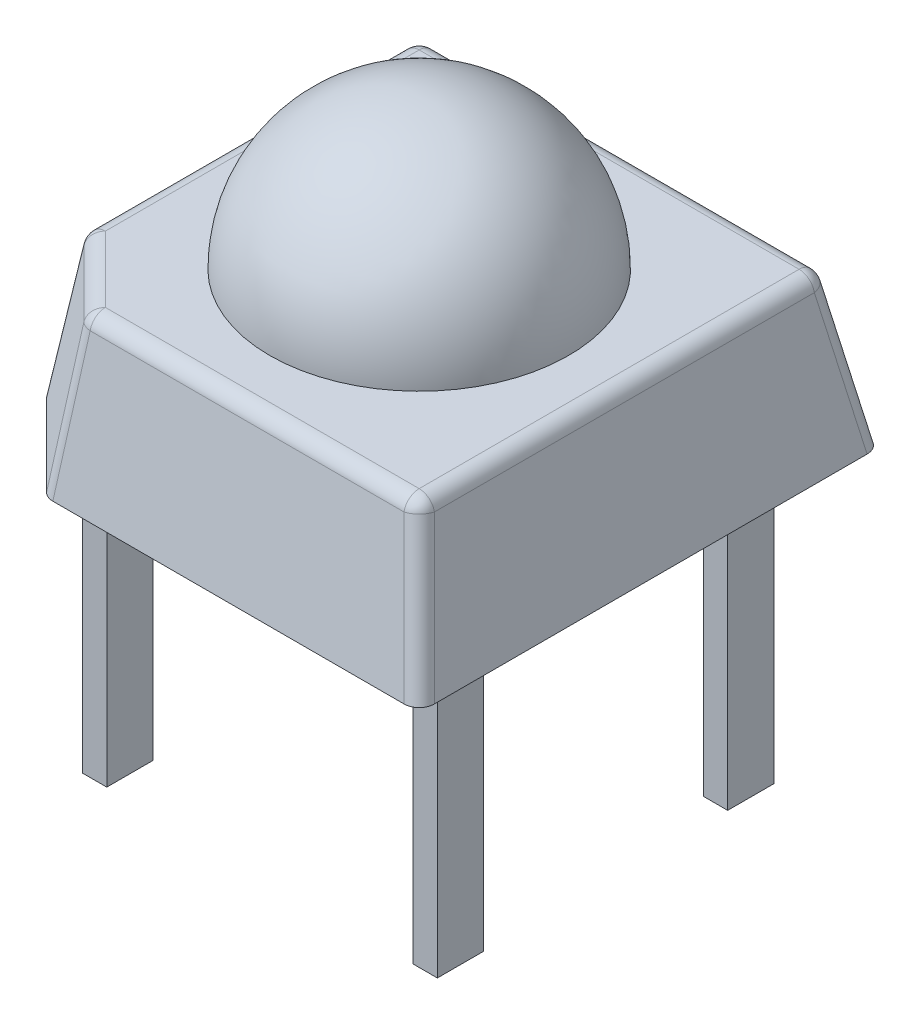
from build123d import *

# Parameters (mm, degrees)
BOSS_EXTRUDE1_DEPTH      = 2.5
CHAMFER1_SIZE            = 2.65
CHAMFER1_SIZE_2          = 0.5
FILLET1_R                = 0.254
REVOLVE1_ANGLE           = 180
REVOLVE1_OTHER_WAY_ANGLE = 180
SKETCH3_W                = 0.4
SKETCH3_H                = 0.76
BOSS_EXTRUDE2_DEPTH      = 4.8


with BuildPart() as part:
    # Sketch1 → Boss-Extrude1 (new body)
    with BuildSketch(Plane(origin=(0, 0, 0), x_dir=(1, 0, 0), z_dir=(0, 1, 0))):
        Polygon((-3.825, -2.325), (-2.325, -3.825), (3.825, -3.825), (3.825, 3.825), (-3.825, 3.825), align=None)
    extrude(amount=BOSS_EXTRUDE1_DEPTH)

    # Chamfer1
    # the kernel refuses this chamfer: 2.65, 0.5 mm, written as the material it takes off along each edge
    with BuildSketch(Plane(origin=(3.825, 2.5, 10.710580639), x_dir=(0.007135648431947453, -0.9999745409366458, 0), z_dir=(0, 0, -1)), Plane(origin=(10.710580639, 2.5, -3.825), x_dir=(0, -0.9999745409366458, -0.007135648431947453), z_dir=(-1, 0, 0))) as chamfer1_piece_1:
        Polygon((CHAMFER1_SIZE * 0.999974540937, CHAMFER1_SIZE * 0.00713564843195), (-CHAMFER1_SIZE_2 * 0.00713564843195, CHAMFER1_SIZE_2 * 0.999974540937), (0, 0), align=None)
    extrude(amount=21.421161277, mode=Mode.SUBTRACT)
    with BuildSketch(Plane(origin=(-3.825, 2.5, -10.710580639), x_dir=(-0.007135648431947453, -0.9999745409366458, 0), z_dir=(0, 0, 1)), Plane(origin=(-9.210580639, 2.5, 3.825), x_dir=(0, -0.9999745409366458, 0.007135648431947453), z_dir=(1, 0, 0))) as chamfer1_piece_2:
        Polygon((CHAMFER1_SIZE * 0.999974540937, CHAMFER1_SIZE * 0.00713564843195), (-CHAMFER1_SIZE_2 * 0.00713564843195, CHAMFER1_SIZE_2 * 0.999974540937), (0, 0), align=None)
    extrude(amount=19.921161277, mode=Mode.SUBTRACT)
    with BuildSketch(Plane(origin=(-8.693840762, 2.5, -2.543840762), x_dir=(-0.0050456653943929935, -0.9999745409366458, 0.005045665394392992), z_dir=(0.7071067811865475, 0, 0.7071067811865476))) as chamfer1_piece_3:
        Polygon((CHAMFER1_SIZE * 0.999974540937, CHAMFER1_SIZE * 0.00713564843195), (-CHAMFER1_SIZE_2 * 0.00713564843195, CHAMFER1_SIZE_2 * 0.999974540937), (0, 0), align=None)
    extrude(amount=15.892481621, mode=Mode.SUBTRACT)

    # Fillet1
    fillet1_edges = [part.edges().sort_by_distance(p)[0] for p in [
        (0.603553391, 2.5, 3.325),
        (-2.721446609, 2.5, 2.721446609),
        (-3.325, 2.5, -0.603553391),
        (0, 2.5, -3.325),
        (3.325, 2.5, 0),
        (-3.560849057, 1.25, 2.215585097),
        (-2.215585097, 1.25, 3.560849057),
        (-3.560849057, 1.25, -3.560849057),
        (3.560849057, 1.25, 3.560849057),
        (3.560849057, 1.25, -3.560849057),
    ]]
    fillet(fillet1_edges, radius=FILLET1_R)

    # Sketch2 → Revolve1 (revolve)
    with BuildSketch(Plane(origin=(0, 2.5, 0), x_dir=(1, 0, 0), z_dir=(0, 1, 0))):
        with BuildLine():
            Line((0, -2.45), (0, 2.45))
            ThreePointArc((0, 2.45), (2.45, 0), (0, -2.45))
        make_face()
    revolve(axis=Axis((0, 2.5, 2.45), (0, 0, -1)), revolution_arc=REVOLVE1_ANGLE)

    # Sketch2 → Revolve1 other way (revolve)
    with BuildSketch(Plane(origin=(0, 2.5, 0), x_dir=(1, 0, 0), z_dir=(0, 1, 0))):
        with BuildLine():
            Line((0, -2.45), (0, 2.45))
            ThreePointArc((0, 2.45), (2.45, 0), (0, -2.45))
        make_face()
    revolve(axis=Axis((0, 2.5, 2.45), (0, 0, 1)), revolution_arc=REVOLVE1_OTHER_WAY_ANGLE)

    # Sketch3 → Boss-Extrude2 (add)
    with BuildSketch(Plane.XZ):
        with Locations((-2.707698113, 2.234442884)):
            Rectangle(SKETCH3_W, SKETCH3_H)
        with Locations((-2.707698113, -2.525557116)):
            Rectangle(SKETCH3_W, SKETCH3_H)
        with Locations((2.712301887, -2.525557116)):
            Rectangle(SKETCH3_W, SKETCH3_H)
        with Locations((2.712301887, 2.234442884)):
            Rectangle(SKETCH3_W, SKETCH3_H)
    extrude(amount=BOSS_EXTRUDE2_DEPTH)


solid = part.part
